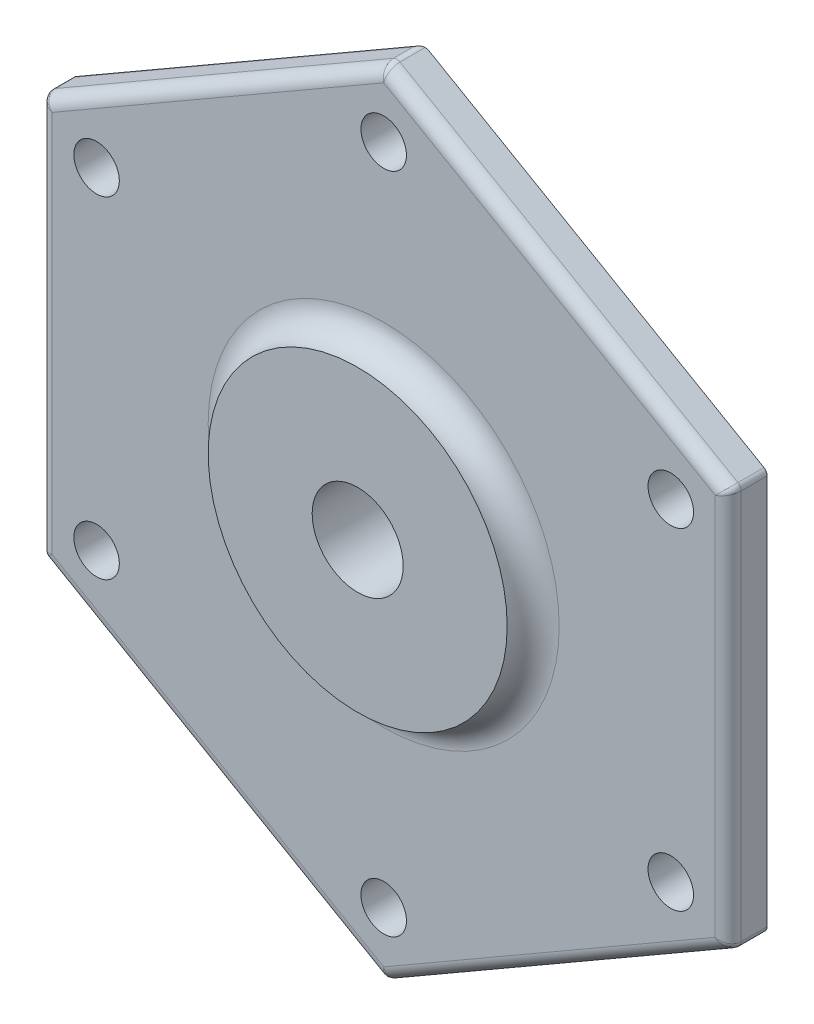
from build123d import *

# Parameters (mm, degrees)
SKETCH1_R           = 3.5
SKETCH1_R_2         = 7
BOSS_EXTRUDE1_DEPTH = 16
SKETCH3_R           = 23
CUT_EXTRUDE1_DEPTH  = 4
SKETCH4_R           = 45
SKETCH4_R_2         = 3.5
SKETCH4_R_3         = 40
SKETCH4_R_4         = 19
SKETCH4_R_5         = 14
SKETCH4_R_6         = 7
CUT_EXTRUDE2_DEPTH  = 6
FILLET1_R           = 4
FILLET2_R           = 2
CHAMFER1_SIZE       = 1
FILLET4_R           = 1


with BuildPart() as part:
    # Sketch1 → Boss-Extrude1 (new body)
    with BuildSketch(Plane.XY):
        Polygon((-53, -30.599564267), (0, -61.199128534), (53, -30.599564267), (53, 30.599564267), (0, 61.199128534), (-53, 30.599564267), align=None)
        with Locations((0, 51)):
            Circle(SKETCH1_R, mode=Mode.SUBTRACT)
        with Locations((44.167295593, 25.5)):
            Circle(SKETCH1_R, mode=Mode.SUBTRACT)
        with Locations((44.167295593, -25.5)):
            Circle(SKETCH1_R, mode=Mode.SUBTRACT)
        with Locations((0, -51)):
            Circle(SKETCH1_R, mode=Mode.SUBTRACT)
        with Locations((-44.167295593, -25.5)):
            Circle(SKETCH1_R, mode=Mode.SUBTRACT)
        with Locations((-44.167295593, 25.5)):
            Circle(SKETCH1_R, mode=Mode.SUBTRACT)
        Circle(SKETCH1_R_2, mode=Mode.SUBTRACT)
    extrude(amount=BOSS_EXTRUDE1_DEPTH)

    # Sketch3 → Cut-Extrude1 (cut)
    with BuildSketch(Plane.XY.offset(16)):
        Polygon((-53, 30.599564267), (-53, -30.599564267), (0, -61.199128534), (53, -30.599564267), (53, 30.599564267), (0, 61.199128534), align=None)
        Circle(SKETCH3_R, mode=Mode.SUBTRACT)
    extrude(amount=-CUT_EXTRUDE1_DEPTH, mode=Mode.SUBTRACT)

    # Sketch4 → Cut-Extrude2 (cut)
    # profile 1 of 3: a face of its own
    with BuildSketch(Plane(origin=(0, 0, 0), x_dir=(-1, 0, 0), z_dir=(0, 0, -1))):
        Polygon((0, -61.199128534), (53, -30.599564267), (53, 30.599564267), (0, 61.199128534), (-53, 30.599564267), (-53, -30.599564267), align=None)
        Circle(SKETCH4_R, mode=Mode.SUBTRACT)
        with Locations((0, 51)):
            Circle(SKETCH4_R_2, mode=Mode.SUBTRACT)
        with Locations((-44.167295593, 25.5)):
            Circle(SKETCH4_R_2, mode=Mode.SUBTRACT)
        with Locations((0, -51)):
            Circle(SKETCH4_R_2, mode=Mode.SUBTRACT)
        with Locations((44.167295593, 25.5)):
            Circle(SKETCH4_R_2, mode=Mode.SUBTRACT)
        with Locations((44.167295593, -25.5)):
            Circle(SKETCH4_R_2, mode=Mode.SUBTRACT)
        with Locations((-44.167295593, -25.5)):
            Circle(SKETCH4_R_2, mode=Mode.SUBTRACT)
    # profile 2 of 3: a face of its own
    with BuildSketch(Plane(origin=(0, 0, 0), x_dir=(-1, 0, 0), z_dir=(0, 0, -1))):
        Circle(SKETCH4_R_3)
        Circle(SKETCH4_R_4, mode=Mode.SUBTRACT)
    # profile 3 of 3: a face of its own
    with BuildSketch(Plane(origin=(0, 0, 0), x_dir=(-1, 0, 0), z_dir=(0, 0, -1))):
        Circle(SKETCH4_R_5)
        Circle(SKETCH4_R_6, mode=Mode.SUBTRACT)
    extrude(amount=-CUT_EXTRUDE2_DEPTH, mode=Mode.SUBTRACT)

    # Fillet1
    fillet1_edges = [part.edges().sort_by_distance(p)[0] for p in [
        (-23, 0, 12),
    ]]
    fillet(fillet1_edges, radius=FILLET1_R - 0.0001)  # a hair under: the kernel refuses the full size

    # Fillet2
    fillet2_edges = [part.edges().sort_by_distance(p)[0] for p in [
        (19, 0, 6),
        (-26.5, 45.899346401, 12),
        (26.5, 45.899346401, 12),
        (53, 0, 12),
        (26.5, -45.899346401, 12),
        (-26.5, -45.899346401, 12),
        (-53, 0, 12),
        (40, 0, 6),
    ]]
    fillet(fillet2_edges, radius=FILLET2_R)

    # Chamfer1
    chamfer1_edges = [part.edges().sort_by_distance(p)[0] for p in [
        (45, 0, 0),
    ]]
    chamfer(chamfer1_edges, length=CHAMFER1_SIZE)

    # Fillet4
    fillet4_edges = [part.edges().sort_by_distance(p)[0] for p in [
        (-26.5, 45.899346401, 6),
        (-53, 30.599564267, 8),
        (0, 61.199128534, 8),
        (-53, -30.599564267, 8),
        (0, -61.199128534, 8),
        (53, -30.599564267, 8),
        (53, 30.599564267, 8),
        (52.362858156, -30.231710252, 11.463768304),
        (0, -60.463420503, 11.463768304),
        (52.362858156, 30.231710252, 11.463768304),
        (-52.362858156, -30.231710252, 11.463768304),
        (0, 60.463420503, 11.463768304),
        (-52.362858156, 30.231710252, 11.463768304),
    ]]
    fillet(fillet4_edges, radius=FILLET4_R)


solid = part.part
